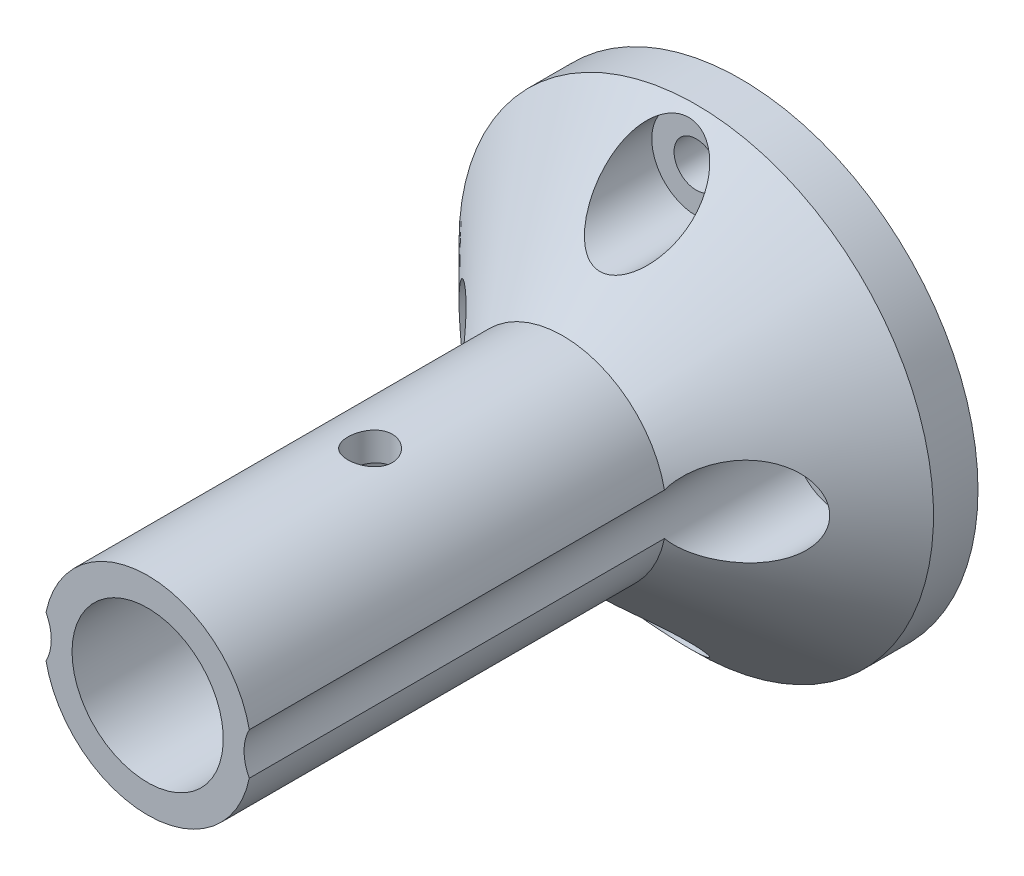
from build123d import *

# Parameters (mm, degrees)
SKETCH_1_R               = 16
EXTRUDE_1_DEPTH          = 40
SKETCH_2_W               = 5.1
SKETCH_2_H               = 40
SKETCH_3_R               = 1.5
CUT_EXTRUDE_2_DEPTH      = 46.956501172
SKETCH_4_R               = 3
SKETCH_4_R_2             = 1.5
CUT_EXTRUDE_3_DEPTH      = 44.370496958
CUT_EXTRUDE_4_DEPTH      = 46.956501329
CUT_EXTRUDE_4_DEPTH_BACK = 46.956501329
SKETCH_5_R               = 1.5


with BuildPart() as part:
    # 草图1 → 凸台-拉伸1 (new body)
    with BuildSketch(Plane.XY):
        Circle(SKETCH_1_R)
    extrude(amount=EXTRUDE_1_DEPTH)

    # 草图2 → 切除-旋转1 (revolve, cut)
    with BuildSketch(Plane(origin=(0, 0, 0), x_dir=(1, 0, 0), z_dir=(0, 1, 0))):
        Polygon((-16, -40), (-16, -3), (-7, -12), (-7, -40), align=None)
        with Locations((-2.55, -20)):
            Rectangle(SKETCH_2_W, SKETCH_2_H)
    revolve(axis=Axis((0, 0, 0), (0, 0, 1)), mode=Mode.SUBTRACT)

    # 草图3 → 切除-拉伸2 (cut, through all)
    with BuildSketch(Plane.XY):
        with Locations((0, -12.5)):
            Circle(SKETCH_3_R)
        with Locations((-9.5, 0)):
            Circle(SKETCH_3_R)
        with Locations((9.5, 0)):
            Circle(SKETCH_3_R)
        with Locations((0, 12.5)):
            Circle(SKETCH_3_R)
    extrude(amount=CUT_EXTRUDE_2_DEPTH, mode=Mode.SUBTRACT)

    # 草图4 → 切除-拉伸3 (cut, through all)
    # profile 1 of 4: a face of its own
    with BuildSketch(Plane.XY.offset(3)):
        with Locations((0, 12.5)):
            Circle(SKETCH_4_R)
        with Locations((0, 12.5)):
            Circle(SKETCH_4_R_2, mode=Mode.SUBTRACT)
    # profile 2 of 4: a face of its own
    with BuildSketch(Plane.XY.offset(3)):
        with Locations((-9.5, 0)):
            Circle(SKETCH_4_R)
        with Locations((-9.5, 0)):
            Circle(SKETCH_4_R_2, mode=Mode.SUBTRACT)
    # profile 3 of 4: a face of its own
    with BuildSketch(Plane.XY.offset(3)):
        with Locations((9.5, 0)):
            Circle(SKETCH_4_R)
        with Locations((9.5, 0)):
            Circle(SKETCH_4_R_2, mode=Mode.SUBTRACT)
    # profile 4 of 4: a face of its own
    with BuildSketch(Plane.XY.offset(3)):
        with Locations((0, -12.5)):
            Circle(SKETCH_4_R)
        with Locations((0, -12.5)):
            Circle(SKETCH_4_R_2, mode=Mode.SUBTRACT)
    extrude(amount=CUT_EXTRUDE_3_DEPTH, mode=Mode.SUBTRACT)

    # 草图5 → 切除-拉伸4 (cut, two sides: drawn at the far end of the back side and taken through both)
    with BuildSketch(Plane(origin=(0, 0, 0), x_dir=(1, 0, 0), z_dir=(0, 1, 0)).offset(-CUT_EXTRUDE_4_DEPTH_BACK)):
        with Locations((0, -25)):
            Circle(SKETCH_5_R)
    extrude(amount=CUT_EXTRUDE_4_DEPTH + CUT_EXTRUDE_4_DEPTH_BACK, mode=Mode.SUBTRACT)


solid = part.part
